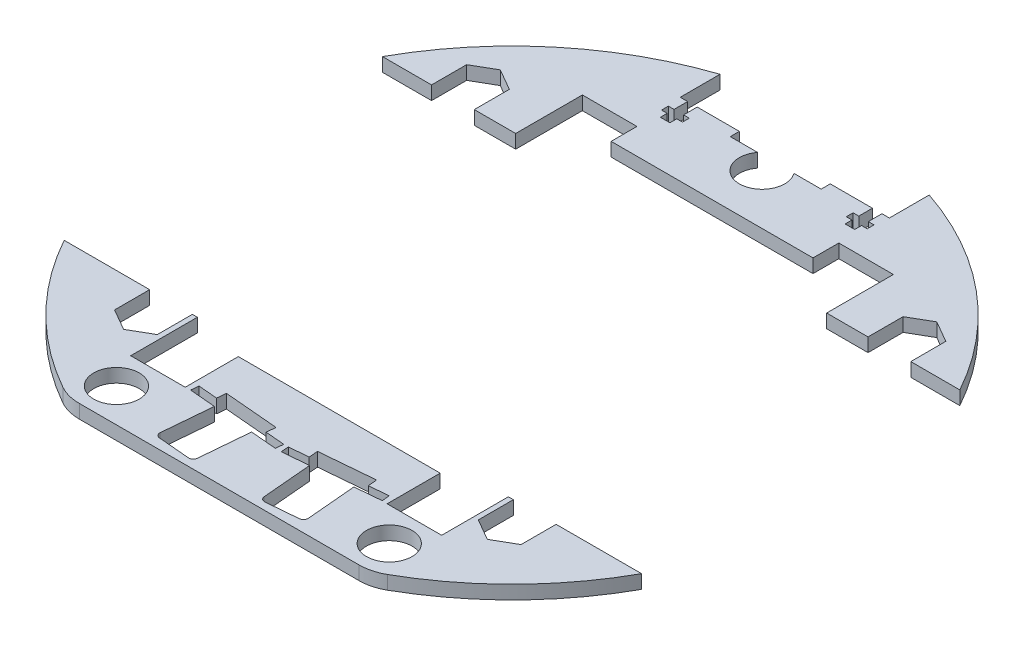
from build123d import *

# Parameters (mm, degrees)
BOSS_EXTRUDE1_DEPTH = 3
CUT_EXTRUDE1_DEPTH  = 103.574363269
SKETCH3_W           = 38.3
SKETCH3_H           = 70
CUT_EXTRUDE2_DEPTH  = 103.574363269
CUT_EXTRUDE3_DEPTH  = 97.418359248
CUT_EXTRUDE4_DEPTH  = 97.418359248
CUT_EXTRUDE5_DEPTH  = 97.418359248
SKETCH7_R           = 5
CUT_EXTRUDE6_DEPTH  = 94.63492938
CUT_EXTRUDE7_DEPTH  = 94.63492938
SKETCH9_W           = 4.6
SKETCH9_H           = 1.5
CUT_EXTRUDE8_DEPTH  = 94.63492938
SKETCH10_W          = 2.1
SKETCH10_H          = 3
SKETCH10_H_2        = 1.5
CUT_EXTRUDE9_DEPTH  = 94.63492938
SKETCH11_R          = 5
CUT_EXTRUDE10_DEPTH = 94.63492938


with BuildPart() as part:
    # Sketch1 → Boss-Extrude1 (new body)
    with BuildSketch(Plane(origin=(0, 0, 0), x_dir=(1, 0, 0), z_dir=(0, 1, 0))):
        with BuildLine():
            Line((-30.763446914, -64.404598464), (30.763446914, -64.404598464))
            ThreePointArc((30.763446914, -64.404598464), (33.308308644, -64.075362589), (35.68559842, -63.109334218))
            ThreePointArc((35.68559842, -63.109334218), (0, 72.5), (-35.68559842, -63.109334218))
            ThreePointArc((-35.68559842, -63.109334218), (-33.308308644, -64.075362589), (-30.763446914, -64.404598464))
        make_face()
    extrude(amount=BOSS_EXTRUDE1_DEPTH)

    # Sketch2 → Cut-Extrude1 (cut, through all)
    with BuildSketch(Plane(origin=(0, 3, 0), x_dir=(1, 0, 0), z_dir=(0, 1, 0))):
        Polygon((-34.2, -49.675685802), (-22.2, -49.675685802), (-22.2, -38), (22.2, -38), (22.2, -49.675685802), (34.2, -49.675685802), (34.2, 49.675685802), (22.2, 49.675685802), (22.2, 44), (-22.2, 44), (-22.2, 49.675685802), (-34.2, 49.675685802), align=None)
    extrude(amount=-CUT_EXTRUDE1_DEPTH, mode=Mode.SUBTRACT)

    # Sketch3 → Cut-Extrude2 (cut, through all)
    with BuildSketch(Plane(origin=(0, 3, 0), x_dir=(1, 0, 0), z_dir=(0, 1, 0))):
        with Locations((-53.35, 0)):
            Rectangle(SKETCH3_W, SKETCH3_H)
        with Locations((53.35, 0)):
            Rectangle(SKETCH3_W, SKETCH3_H)
    extrude(amount=-CUT_EXTRUDE2_DEPTH, mode=Mode.SUBTRACT)


with BuildPart() as cut_extrude2_piece_1:
    # of the separate pieces the step leaves, piece 1, a body of its own (cut_extrude2_pieces)
    add(part.part.solids().sort_by_distance((63.492125496, 0, -35))[0])

    # Sketch6 → Cut-Extrude5 (cut, through all)
    with BuildSketch(Plane(origin=(0, 3, 0), x_dir=(1, 0, 0), z_dir=(0, 1, 0))):
        Polygon((-23, 72.5), (23, 72.5), (23, 60), (10, 60), (10, 58), (-10, 58), (-10, 60), (-23, 60), align=None)
    extrude(amount=-CUT_EXTRUDE5_DEPTH, mode=Mode.SUBTRACT)


with BuildPart() as cut_extrude2_piece_2:
    # of the separate pieces the step leaves, piece 2, a body of its own (cut_extrude2_pieces)
    add(part.part.solids().sort_by_distance((-35.68559842, 0, 63.109334218))[0])

    # Sketch4 → Cut-Extrude3 (cut, through all)
    with BuildSketch(Plane(origin=(0, 3, 0), x_dir=(1, 0, 0), z_dir=(0, 1, 0))):
        Polygon((-21.070156074, -49.617905737), (-0.648164763, -51.404598464), (-0.5, -49.711067477), (-20.921991311, -47.924374751), align=None)
        Polygon((21.070156074, -49.617905737), (20.921991311, -47.924374751), (0.5, -49.711067477), (0.648164763, -51.404598464), align=None)
    extrude(amount=-CUT_EXTRUDE3_DEPTH, mode=Mode.SUBTRACT)

    # Sketch5 → Cut-Extrude4 (cut, through all)
    with BuildSketch(Plane(origin=(0, 3, 0), x_dir=(1, 0, 0), z_dir=(0, 1, 0))):
        with BuildLine():
            Line((6.376284277, -50.903452943), (15.34203656, -50.119051258))
            Line((15.34203656, -50.119051258), (16.30074973, -61.077192937))
            ThreePointArc((16.30074973, -61.077192937), (16.070599475, -61.80713629), (15.391710774, -62.160543378))
            Line((15.391710774, -62.160543378), (8.418347888, -62.770633577))
            ThreePointArc((8.418347888, -62.770633577), (7.688404535, -62.540483322), (7.334997447, -61.861594622))
            Line((7.334997447, -61.861594622), (6.376284277, -50.903452943))
        make_face()
        Polygon((16.688163844, -48.294786657), (4.733827467, -49.34065557), (4.559515981, -47.348266174), (16.513852358, -46.302397261), align=None)
        Polygon((-16.513852358, -46.302397261), (-4.559515981, -47.348266174), (-4.733827467, -49.34065557), (-16.688163844, -48.294786657), align=None)
        with BuildLine():
            Line((-8.418347888, -62.770633577), (-15.391710774, -62.160543378))
            ThreePointArc((-15.391710774, -62.160543378), (-16.070599475, -61.80713629), (-16.30074973, -61.077192937))
            Line((-16.30074973, -61.077192937), (-15.34203656, -50.119051258))
            Line((-15.34203656, -50.119051258), (-6.376284277, -50.903452943))
            Line((-6.376284277, -50.903452943), (-7.334997447, -61.861594622))
            ThreePointArc((-7.334997447, -61.861594622), (-7.688404535, -62.540483322), (-8.418347888, -62.770633577))
        make_face()
    extrude(amount=-CUT_EXTRUDE4_DEPTH, mode=Mode.SUBTRACT)

    # Sketch7 → Cut-Extrude6 (cut, through all)
    with BuildSketch(Plane(origin=(0, 3, 0), x_dir=(1, 0, 0), z_dir=(0, 1, 0))):
        with Locations((-30, -57)):
            Circle(SKETCH7_R)
        with Locations((30, -57)):
            Circle(SKETCH7_R)
    extrude(amount=-CUT_EXTRUDE6_DEPTH, mode=Mode.SUBTRACT)


with BuildPart() as cut_extrude7_tool:
    # Sketch8 → Cut-Extrude7 (new, through all)
    with BuildSketch(Plane(origin=(0, 3, 0), x_dir=(1, 0, 0), z_dir=(0, 1, 0))):
        Polygon((-52.7, 37.286453735), (-52.7, 32.5), (-43.3, 32.5), (-43.3, 37.286453735), (-43.3, 42.713546265), (-48, 45.42709253), (-52.7, 42.713546265), align=None)
        Polygon((44.7, -32.5), (35.3, -32.5), (35.3, -37.286453735), (35.3, -42.713546265), (40, -45.42709253), (44.7, -42.713546265), (44.7, -37.286453735), align=None)
        Polygon((-35.3, -37.286453735), (-35.3, -32.5), (-44.7, -32.5), (-44.7, -37.286453735), (-44.7, -42.713546265), (-40, -45.42709253), (-35.3, -42.713546265), align=None)
        Polygon((52.7, 32.5), (52.7, 37.286453735), (52.7, 42.713546265), (48, 45.42709253), (43.3, 42.713546265), (43.3, 37.286453735), (43.3, 32.5), align=None)
    extrude(amount=-CUT_EXTRUDE7_DEPTH)


with BuildPart() as cut_extrude2_piece_1_1:
    add(cut_extrude2_piece_1.part)

    # Cut-Extrude7: cut by cut_extrude7_tool
    add(cut_extrude7_tool.part, mode=Mode.SUBTRACT)

    # Sketch9 → Cut-Extrude8 (cut, through all)
    with BuildSketch(Plane(origin=(0, 3, 0), x_dir=(1, 0, 0), z_dir=(0, 1, 0))):
        with Locations((20.32, 56.25)):
            Rectangle(SKETCH9_W, SKETCH9_H)
        with Locations((-20.32, 56.25)):
            Rectangle(SKETCH9_W, SKETCH9_H)
    extrude(amount=-CUT_EXTRUDE8_DEPTH, mode=Mode.SUBTRACT)

    # Sketch10 → Cut-Extrude9 (cut, through all)
    with BuildSketch(Plane(origin=(0, 3, 0), x_dir=(1, 0, 0), z_dir=(0, 1, 0))):
        with Locations((20.32, 58.5)):
            Rectangle(SKETCH10_W, SKETCH10_H)
        with Locations((20.32, 54.75)):
            Rectangle(SKETCH10_W, SKETCH10_H_2)
        with Locations((-20.32, 54.75)):
            Rectangle(SKETCH10_W, SKETCH10_H_2)
        with Locations((-20.32, 58.5)):
            Rectangle(SKETCH10_W, SKETCH10_H)
    extrude(amount=-CUT_EXTRUDE9_DEPTH, mode=Mode.SUBTRACT)

    # Sketch11 → Cut-Extrude10 (cut, through all)
    with BuildSketch(Plane(origin=(0, 3, 0), x_dir=(1, 0, 0), z_dir=(0, 1, 0))):
        with Locations((0, 55)):
            Circle(SKETCH11_R)
    extrude(amount=-CUT_EXTRUDE10_DEPTH, mode=Mode.SUBTRACT)


with BuildPart() as cut_extrude2_piece_2_1:
    add(cut_extrude2_piece_2.part)

    # Cut-Extrude7: cut by cut_extrude7_tool
    add(cut_extrude7_tool.part, mode=Mode.SUBTRACT)


solid = Compound([cut_extrude2_piece_1_1.part, cut_extrude2_piece_2_1.part])
